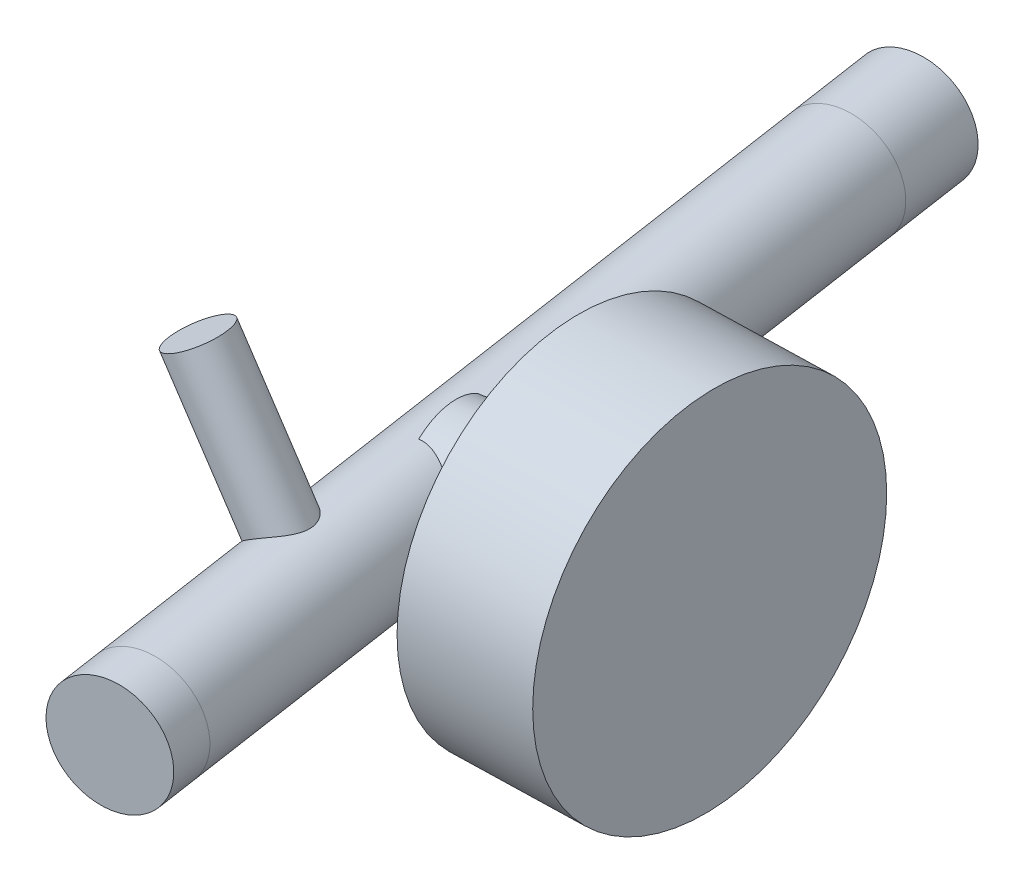
from build123d import *

# Parameters (mm, degrees)
SUSP_RR_UCA_BALL_JOINT_PROFILE_R  = 17
SUSP_RR_LCA_BALL_JOINT_PROFILE_R  = 17
SUSP_RR_UPRIGHT_KINGPIN_START     = -222.059535791
SUSP_RR_UPRIGHT_KINGPIN_OUTLINE_R = 17
SUSP_RR_UPRIGHT_KINGPIN_DEPTH     = 237.230000066
SUSP_RR_UPRIGHT_SPINDLE_PROFILE_R = 20
SUSP_RR_UPRIGHT_ARM_PROFILE_R     = 9
SUSP_RR_HUB_PROFILE_R             = 55


# Read off the part's stored shape, not the designer's step: SUSP_RR_upright_kingpin
with BuildPart() as part:
    # SUSP_RR_UCA_ball_joint: sweep along a curve in space
    with BuildLine() as susp_rr_uca_ball_joint_path:
        Line((521.613651, 1419.6, -302.481439), (517.770606, 1419.6, -328.195852))
    # SUSP_RR_UCA_ball_joint profile (on start of the path) → SUSP_RR_UCA_ball_joint (sweep)
    with BuildSketch(Plane(origin=(521.613651, 1419.6, -302.481439), x_dir=(-0.9890158620797268, 0, 0.14780941970894487), z_dir=(-0.14780941970894487, 0, -0.9890158620797268))):
        Circle(SUSP_RR_UCA_BALL_JOINT_PROFILE_R)
    sweep(path=susp_rr_uca_ball_joint_path.line)


with BuildPart() as body_2:
    # SUSP_RR_LCA_ball_joint: sweep along a curve in space
    with BuildLine() as susp_rr_lca_ball_joint_path:
        Line((560.521522, 1419.6, -42.1427938), (556.678478, 1419.6, -67.8572062))
    # SUSP_RR_LCA_ball_joint profile (on start of the path) → SUSP_RR_LCA_ball_joint (sweep)
    with BuildSketch(Plane(origin=(560.521522, 1419.6, -42.1427938), x_dir=(-0.9890158671980833, 0, 0.14780938546121916), z_dir=(-0.14780938546121916, 0, -0.9890158671980833))):
        Circle(SUSP_RR_LCA_BALL_JOINT_PROFILE_R)
    sweep(path=susp_rr_lca_ball_joint_path.line)


with BuildPart() as susp_rr_upright_kingpin_tool:
    # SUSP_RR_upright_kingpin outline → SUSP_RR_upright_kingpin (new body)
    with BuildSketch(Plane(origin=(0, 0, 0), x_dir=(0.9890158635477251, 0, -0.14780940988633906), z_dir=(0.14780940988633903, 0, 0.9890158635477251)).offset(SUSP_RR_UPRIGHT_KINGPIN_START)):
        with Locations((560.593778922, 1419.6)):
            Circle(SUSP_RR_UPRIGHT_KINGPIN_OUTLINE_R)
    extrude(amount=SUSP_RR_UPRIGHT_KINGPIN_DEPTH)


with BuildPart() as part_1:
    add(part.part)


with BuildPart() as part_2:
    # SUSP_RR_upright_kingpin: joined with susp_rr_upright_kingpin_tool
    add(part_1.part.fuse(susp_rr_upright_kingpin_tool.part, body_2.part, tol=0.00001))

    # SUSP_RR_upright_spindle: sweep along a curve in space
    with BuildLine() as susp_rr_upright_spindle_path:
        Line((542.552954, 1419.6, -162.373292), (593.584449, 1419.6, -170))
    # SUSP_RR_upright_spindle profile (on start of the path) → SUSP_RR_upright_spindle (sweep)
    with BuildSketch(Plane(origin=(542.552954, 1419.6, -162.373292), x_dir=(0.14780941059704947, 0, 0.9890158634415087), z_dir=(0.9890158634415087, 0, -0.14780941059704947))):
        Circle(SUSP_RR_UPRIGHT_SPINDLE_PROFILE_R)
    sweep(path=susp_rr_upright_spindle_path.line)

    # SUSP_RR_upright_arm: sweep along a curve in space
    with BuildLine() as susp_rr_upright_arm_path:
        Line((549.94905, 1419.6, -112.88486), (520.81, 1474.2, -108.53))
    # SUSP_RR_upright_arm profile (on start of the path) → SUSP_RR_upright_arm (sweep)
    with BuildSketch(Plane(origin=(549.94905, 1419.6, -112.88486), x_dir=(0.8822250985406449, 0.47082786186137016, 0), z_dir=(-0.46966656036901244, 0.8800490817699289, 0.07019213450982756))):
        Circle(SUSP_RR_UPRIGHT_ARM_PROFILE_R)
    sweep(path=susp_rr_upright_arm_path.line)

    # SUSP_RR_hub: sweep along a curve in space
    with BuildLine() as susp_rr_hub_path:
        Line((573.591303, 1419.6, -169.476461), (613.577596, 1419.6, -170.523539))
    # SUSP_RR_hub profile (on start of the path) → SUSP_RR_hub (sweep)
    with BuildSketch(Plane(origin=(573.591303, 1419.6, -169.476461), x_dir=(0.026176949998200902, 0, 0.9996573249312944), z_dir=(0.9996573249312944, 0, -0.026176949998200902))):
        Circle(SUSP_RR_HUB_PROFILE_R)
    sweep(path=susp_rr_hub_path.line)


solid = part_2.part
